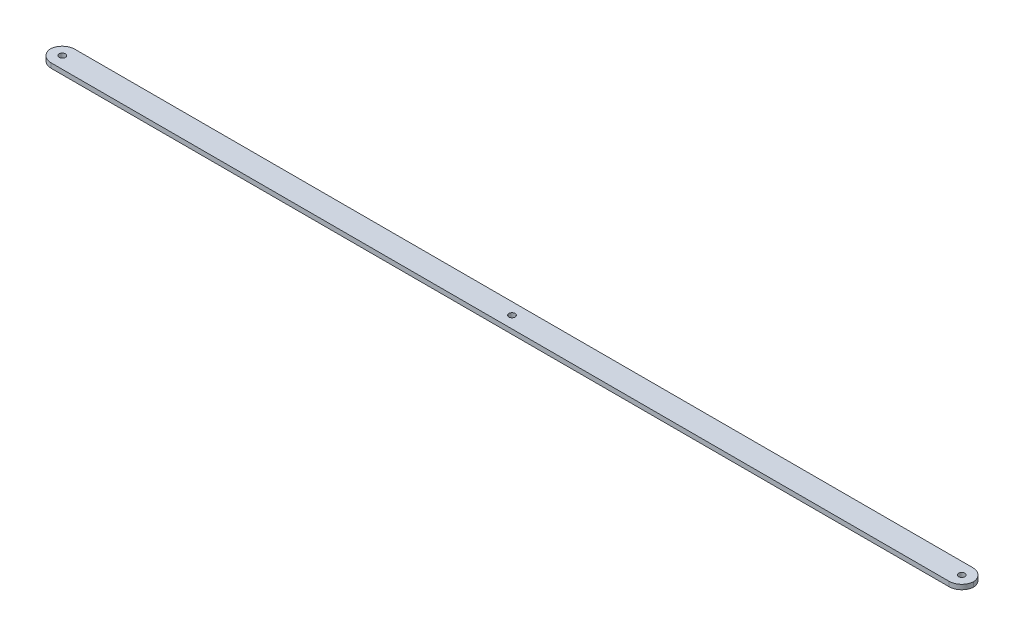
from build123d import *

# Parameters (mm, degrees)
SKETCH1_W           = 285
SKETCH1_H           = 15
SKETCH1_R           = 2
SKETCH1_W_2         = 15
BOSS_EXTRUDE1_DEPTH = 3
FILLET1_R           = 8


with BuildPart() as part:
    # Sketch1 → Boss-Extrude1 (new body)
    # profile 1 of 3: a face of its own
    with BuildSketch(Plane(origin=(0, 0, 0), x_dir=(1, 0, 0), z_dir=(0, 1, 0))):
        with Locations((-7.5, 0)):
            Rectangle(SKETCH1_W, SKETCH1_H)
        with Locations(Location((-142.5, 0, 0), (0, 0, 270))):
            Circle(SKETCH1_R, mode=Mode.SUBTRACT)
    # profile 2 of 3: a face of its own
    with BuildSketch(Plane(origin=(0, 0, 0), x_dir=(1, 0, 0), z_dir=(0, 1, 0))):
        with Locations((292.5, 0)):
            Rectangle(SKETCH1_W, SKETCH1_H)
        with Locations(Location((427.5, 0, 0), (0, 0, 270))):
            Circle(SKETCH1_R, mode=Mode.SUBTRACT)
    # profile 3 of 3: a face of its own
    with BuildSketch(Plane(origin=(0, 0, 0), x_dir=(1, 0, 0), z_dir=(0, 1, 0))):
        with Locations((142.5, 0)):
            Rectangle(SKETCH1_W_2, SKETCH1_H)
        with Locations(Location((142.5, 0, 0), (0, 0, 270))):
            Circle(SKETCH1_R, mode=Mode.SUBTRACT)
    extrude(amount=BOSS_EXTRUDE1_DEPTH)

    # Fillet1
    # the kernel refuses this fillet: 8 mm, written as the material it takes off along each edge
    with BuildSketch(Plane(origin=(-150, -20, 7.5), x_dir=(1, 0, 0), z_dir=(0, 1, 0)), Plane(origin=(435, -20, -7.5), x_dir=(-1, 0, 0), z_dir=(0, 1, 0))) as fillet1_piece_1:
        with BuildLine():
            CenterArc((FILLET1_R, FILLET1_R), FILLET1_R, 180, 90)
            Line((0, FILLET1_R), (0, 0))
            Line((0, 0), (FILLET1_R, 0))
        make_face()
    extrude(amount=43, mode=Mode.SUBTRACT)
    with BuildSketch(Plane(origin=(-150, -20, -7.5), x_dir=(1, 0, 0), z_dir=(0, 1, 0)), Plane(origin=(435, -20, 7.5), x_dir=(-1, 0, 0), z_dir=(0, 1, 0))) as fillet1_piece_2:
        with BuildLine():
            CenterArc((FILLET1_R, -FILLET1_R), FILLET1_R, 90, 90)
            Line((0, -FILLET1_R), (0, 0))
            Line((0, 0), (FILLET1_R, 0))
        make_face()
    extrude(amount=43, mode=Mode.SUBTRACT)


solid = part.part
